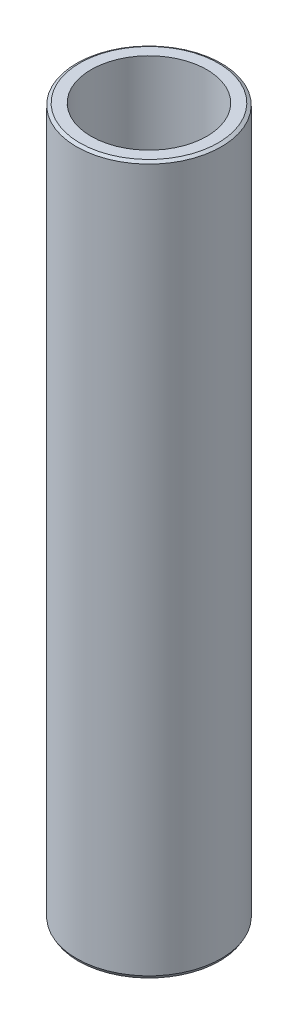
from build123d import *
from OCP.BRepFilletAPI import BRepFilletAPI_MakeChamfer

# Parameters (mm, degrees)
SKETCH1_R           = 52.5
BOSS_EXTRUDE1_DEPTH = 513.77342198
SKETCH2_R           = 41.979187962
CUT_EXTRUDE1_DEPTH  = 520.110420945
CHAMFER1_SIZE       = 1.315273823
CHAMFER1_SIZE2      = 2.278121088


with BuildPart() as part:
    # Sketch1 → Boss-Extrude1 (new body)
    with BuildSketch(Plane(origin=(0, 0, 0), x_dir=(1, 0, 0), z_dir=(0, 1, 0))):
        Circle(SKETCH1_R)
    extrude(amount=BOSS_EXTRUDE1_DEPTH)

    # Sketch2 → Cut-Extrude1 (cut, through all)
    with BuildSketch(Plane(origin=(0, 0, 0), x_dir=(1, 0, 0), z_dir=(0, 1, 0))):
        Circle(SKETCH2_R)
    extrude(amount=CUT_EXTRUDE1_DEPTH, mode=Mode.SUBTRACT)

    # Chamfer1: one chamfer whose edges measure the first distance from different faces: ONE call of the kernel's chamfer builder (chamfer() names one face for all edges)
    chamfer1_edges_1 = [part.edges().sort_by_distance(p)[0] for p in [
        (-52.5, 513.77342198, 0),
    ]]
    chamfer1_side_1 = [part.faces().sort_by_distance(p)[0] for p in [
        (-52.5, 256.88671099, 0),
    ]]
    chamfer1_edges_2 = [part.edges().sort_by_distance(p)[0] for p in [
        (-52.5, 0, 0),
    ]]
    chamfer1_side_2 = [part.faces().sort_by_distance(p)[0] for p in [
        (-51.01507576, 0, 0),
    ]]
    chamfer1 = BRepFilletAPI_MakeChamfer(part.part.solid().wrapped)
    for e in chamfer1_edges_1:
        chamfer1.Add(CHAMFER1_SIZE, CHAMFER1_SIZE2, e.wrapped, chamfer1_side_1[0].wrapped)  # the first distance lies on this face
    for e in chamfer1_edges_2:
        chamfer1.Add(CHAMFER1_SIZE, CHAMFER1_SIZE2, e.wrapped, chamfer1_side_2[0].wrapped)  # the first distance lies on this face
    add(Compound.cast(chamfer1.Shape()), mode=Mode.REPLACE)


solid = part.part
